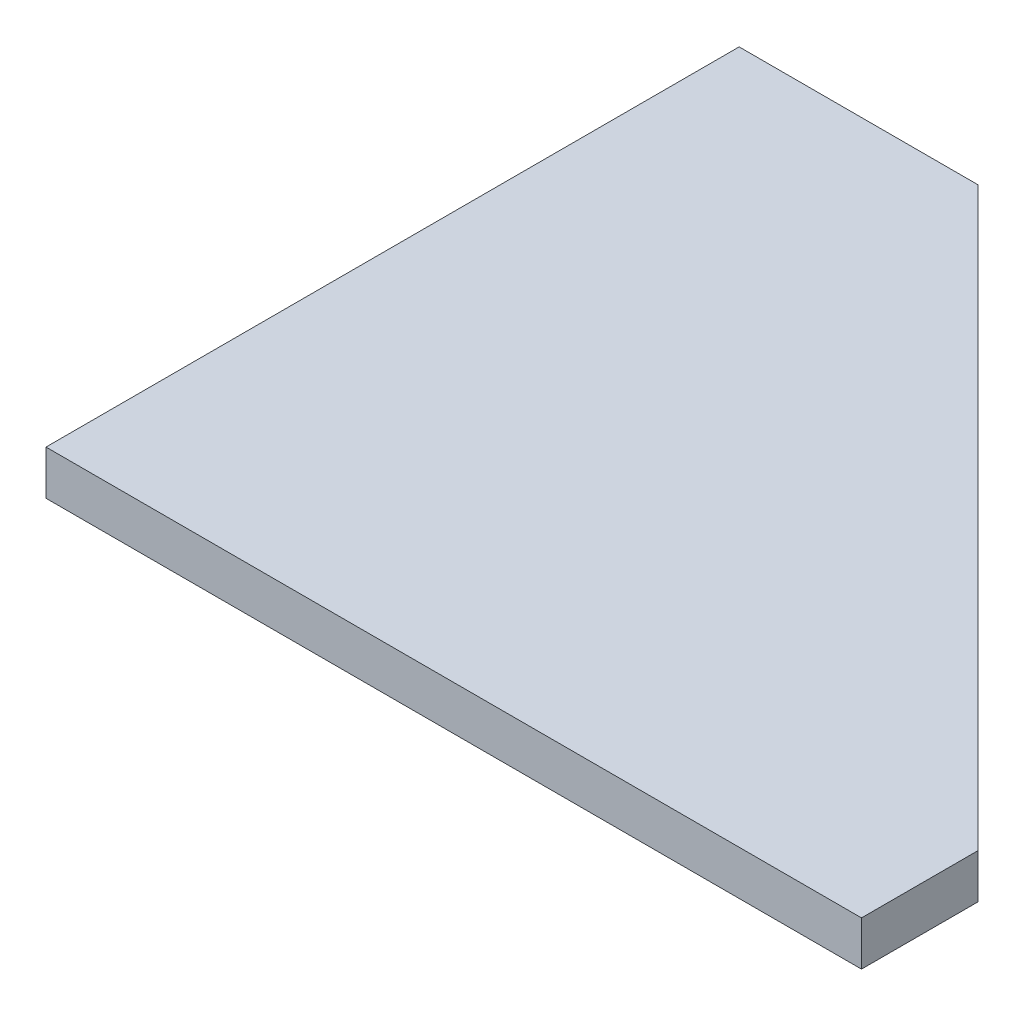
from build123d import *

# Parameters (mm, degrees)
BOSS_EXTRUDE1_DEPTH = 38.1


with BuildPart() as part:
    # Sketch1 → Boss-Extrude1 (new body)
    with BuildSketch(Plane(origin=(0, 0, 0), x_dir=(1, 0, 0), z_dir=(0, 1, 0))):
        Polygon((-144.97, 297.485), (350, -197.485), (350, -297.485), (-350, -297.485), (-350, 297.485), align=None)
    extrude(amount=BOSS_EXTRUDE1_DEPTH)


solid = part.part
